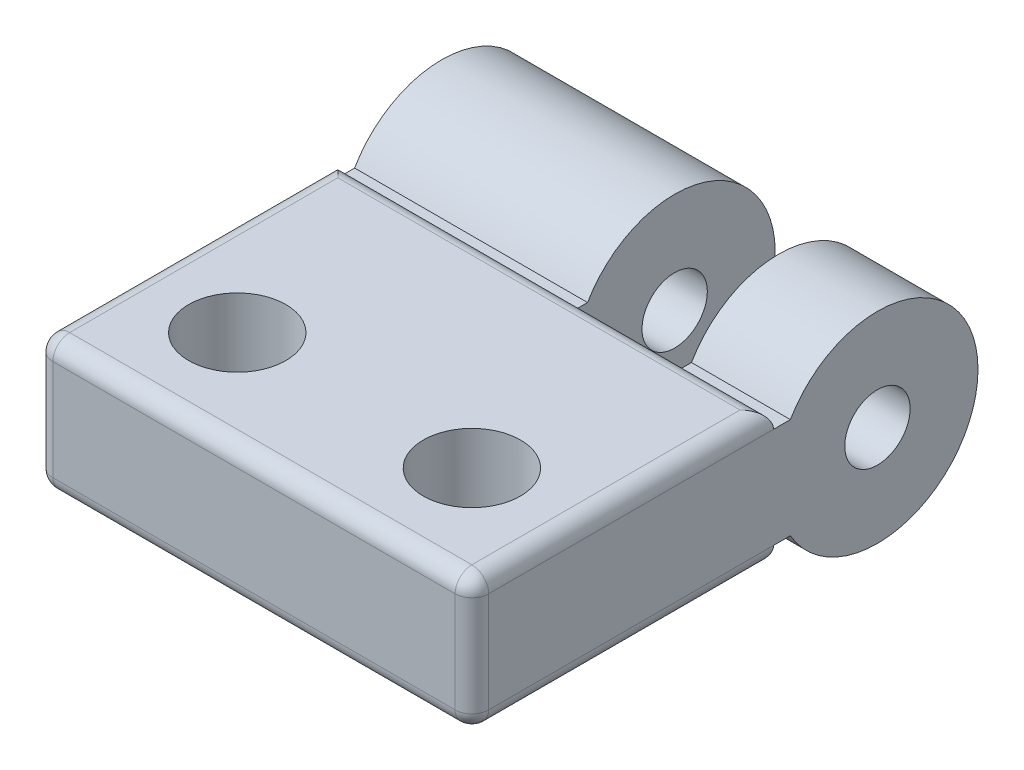
from build123d import *

# Parameters (mm, degrees)
SKETCH1_W           = 9
SKETCH1_H           = 9
BOSS_EXTRUDE1_DEPTH = 3
SKETCH2_W           = 2.95
SKETCH2_H           = 6
BOSS_EXTRUDE2_DEPTH = 6.1
FILLET1_R           = 3
SKETCH3_R           = 0.975
CUT_EXTRUDE1_DEPTH  = 11.1
CUT_EXTRUDE3_DEPTH  = 21.1
BOSS_EXTRUDE3_START = 4
SKETCH5_R           = 3
BOSS_EXTRUDE3_DEPTH = 4
SKETCH8_R           = 1.55
CUT_EXTRUDE4_DEPTH  = 3
CUT_EXTRUDE5_DEPTH  = 0.5
BOSS_EXTRUDE4_START = 4
BOSS_EXTRUDE4_DEPTH = 4
BOSS_EXTRUDE5_DEPTH = 0.5
BOSS_EXTRUDE6_DEPTH = 0.5
SKETCH15_W          = 0.501923789
SKETCH15_H          = 0.5
CUT_EXTRUDE6_DEPTH  = 19.5
SKETCH16_R          = 1.45
CUT_EXTRUDE7_DEPTH  = 19.5
FILLET2_R           = 0.5


with BuildPart() as part:
    # Sketch1 → Boss-Extrude1 (new body)
    with BuildSketch(Plane(origin=(0, 0, 0), x_dir=(1, 0, 0), z_dir=(0, 1, 0))):
        with Locations((4.5, 4.5)):
            Rectangle(SKETCH1_W, SKETCH1_H)
    extrude(amount=BOSS_EXTRUDE1_DEPTH)

    # Sketch2 → Boss-Extrude2 (add)
    with BuildSketch(Plane(origin=(0, 0, -9), x_dir=(-1, 0, 0), z_dir=(0, 0, -1))):
        with Locations((-7.525, 1.5)):
            Rectangle(SKETCH2_W, SKETCH2_H)
        with Locations((-1.475, 1.5)):
            Rectangle(SKETCH2_W, SKETCH2_H)
    extrude(amount=BOSS_EXTRUDE2_DEPTH)

    # Fillet1
    fillet1_edges = [part.edges().sort_by_distance(p)[0] for p in [
        (1.475, 4.5, -15.1),
        (1.475, -1.5, -15.1),
        (7.525, -1.5, -15.1),
        (7.525, 4.5, -15.1),
    ]]
    fillet(fillet1_edges, radius=FILLET1_R - 0.0001)  # a hair under: the kernel refuses the full size

    # Sketch3 → Cut-Extrude1 (cut)
    with BuildSketch(Plane(origin=(9, 0, 0), x_dir=(0, 0, -1), z_dir=(1, 0, 0))):
        with Locations((12.1, 1.5)):
            Circle(SKETCH3_R)
    extrude(amount=-CUT_EXTRUDE1_DEPTH, mode=Mode.SUBTRACT)

    # Sketch6 → Cut-Extrude3 (cut)
    with BuildSketch(Plane.ZY):
        with BuildLine():
            Line((-12.1, 4.5), (-9, 4.5))
            Line((-9, 4.5), (-9, 3))
            Line((-9, 3), (-9.501923789, 3))
            ThreePointArc((-9.501923789, 3), (-10.6, 4.098076211), (-12.1, 4.5))
        make_face()
        with BuildLine():
            Line((-12.1, -1.5), (-9, -1.5))
            Line((-9, -1.5), (-9, 0))
            Line((-9, 0), (-9.501923789, 0))
            ThreePointArc((-9.501923789, 0), (-10.6, -1.098076211), (-12.1, -1.5))
        make_face()
    extrude(amount=-CUT_EXTRUDE3_DEPTH, mode=Mode.SUBTRACT)

    # Sketch5 → Boss-Extrude3 (add)
    with BuildSketch(Plane.ZY.offset(BOSS_EXTRUDE3_START)):
        with Locations((-12.1, 1.5)):
            Circle(SKETCH5_R)
    extrude(amount=-BOSS_EXTRUDE3_DEPTH)

    # Sketch8 → Cut-Extrude4 (cut)
    with BuildSketch(Plane(origin=(0, -1.5, 0), x_dir=(-1, 0, 0), z_dir=(0, -1, 0))):
        with Locations(Location((1.6, 12.1, 0), (0, 0, 90))):
            Circle(SKETCH8_R)
    extrude(amount=-CUT_EXTRUDE4_DEPTH, mode=Mode.SUBTRACT)

    # Sketch9 → Cut-Extrude5 (cut)
    with BuildSketch(Plane.ZY.offset(4)):
        with BuildLine():
            Line((-11.85, 1.5), (-11.85, -0.8))
            ThreePointArc((-11.85, -0.8), (-12.1, -1.05), (-12.35, -0.8))
            Line((-12.35, -0.8), (-12.35, 0.896446609))
            Line((-12.35, 0.896446609), (-13.549568901, -0.303122292))
            ThreePointArc((-13.549568901, -0.303122292), (-13.903122292, -0.303122292), (-13.903122292, 0.050431099))
            Line((-13.903122292, 0.050431099), (-12.703553391, 1.25))
            Line((-12.703553391, 1.25), (-14.4, 1.25))
            ThreePointArc((-14.4, 1.25), (-14.65, 1.5), (-14.4, 1.75))
            Line((-14.4, 1.75), (-12.703553391, 1.75))
            Line((-12.703553391, 1.75), (-13.903122292, 2.949568901))
            ThreePointArc((-13.903122292, 2.949568901), (-13.903122292, 3.303122292), (-13.549568901, 3.303122292))
            Line((-13.549568901, 3.303122292), (-12.35, 2.103553391))
            Line((-12.35, 2.103553391), (-12.35, 3.8))
            ThreePointArc((-12.35, 3.8), (-12.1, 4.05), (-11.85, 3.8))
            Line((-11.85, 3.8), (-11.85, 1.5))
        make_face()
    extrude(amount=-CUT_EXTRUDE5_DEPTH, mode=Mode.SUBTRACT)

    # Sketch10 → Boss-Extrude4 (add)
    with BuildSketch(Plane.ZY.offset(BOSS_EXTRUDE4_START)):
        with BuildLine():
            Line((-9.501923789, 0), (0, 0))
            Line((0, 0), (0, 3))
            Line((0, 3), (-9.501923789, 3))
            ThreePointArc((-9.501923789, 3), (-9.1, 1.5), (-9.501923789, 0))
        make_face()
    extrude(amount=-BOSS_EXTRUDE4_DEPTH)

    # Sketch12 → Boss-Extrude5 (add)
    with BuildSketch(Plane.XZ):
        Polygon((9, 0), (-4, 0), (-4, -9.501923789), (2.95, -9.501923789), (2.95, -9), (6.05, -9), (6.05, -9.501923789), (9, -9.501923789), align=None)
    extrude(amount=BOSS_EXTRUDE5_DEPTH)

    # Sketch13 → Boss-Extrude6 (add)
    with BuildSketch(Plane(origin=(0, 3, 0), x_dir=(1, 0, 0), z_dir=(0, 1, 0))):
        Polygon((2.95, 9.501923789), (-4, 9.501923789), (-4, 0), (9, 0), (9, 9.501923789), (6.05, 9.501923789), (6.05, 9), (2.95, 9), align=None)
    extrude(amount=BOSS_EXTRUDE6_DEPTH)

    # Sketch15 → Cut-Extrude6 (cut)
    with BuildSketch(Plane(origin=(9, 0, 0), x_dir=(0, 0, -1), z_dir=(1, 0, 0))):
        with Locations((9.250961895, 3.25)):
            Rectangle(SKETCH15_W, SKETCH15_H)
        with Locations((9.250961895, -0.25)):
            Rectangle(SKETCH15_W, SKETCH15_H)
    extrude(amount=-CUT_EXTRUDE6_DEPTH, mode=Mode.SUBTRACT)

    # Sketch16 → Cut-Extrude7 (cut)
    with BuildSketch(Plane(origin=(0, 3.5, 0), x_dir=(1, 0, 0), z_dir=(0, 1, 0))):
        with Locations(Location((6, 3, 0), (0, 0, 270))):
            Circle(SKETCH16_R)
        with Locations(Location((-1, 3, 0), (0, 0, 90))):
            Circle(SKETCH16_R)
    extrude(amount=-CUT_EXTRUDE7_DEPTH, mode=Mode.SUBTRACT)

    # Fillet2
    fillet2_edges = [part.edges().sort_by_distance(p)[0] for p in [
        (2.5, 3.5, 0),
        (9, 1.25, 0),
        (2.5, -0.5, 0),
        (-4, 1.5, 0),
        (-4, -0.5, -4.5),
        (-4, 3.5, -4.5),
        (9, 3.5, -4.5),
        (9, -0.5, -4.5),
        (2.5, 3.5, -9),
        (2.5, -0.5, -9),
    ]]
    fillet(fillet2_edges, radius=FILLET2_R - 0.0001)  # a hair under: the kernel refuses the full size


solid = part.part
